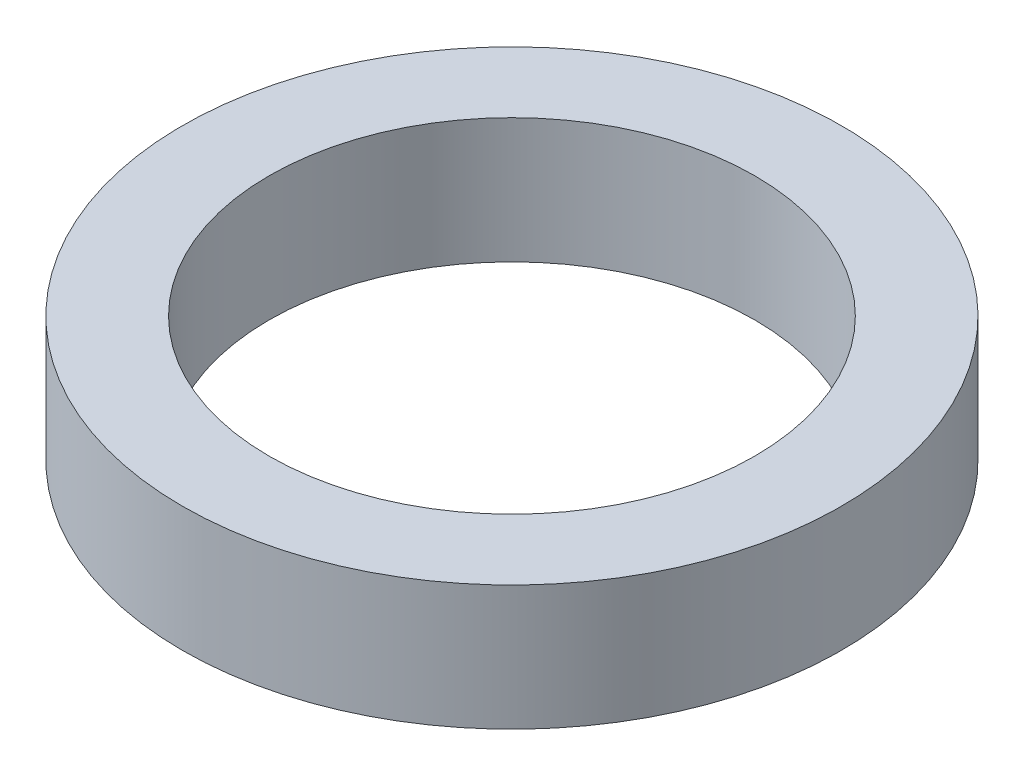
from build123d import *

# Parameters (mm, degrees)
SKETCH1_R           = 47.5
BOSS_EXTRUDE1_DEPTH = 18
SKETCH2_R           = 35
CUT_EXTRUDE1_DEPTH  = 70.544949493


with BuildPart() as part:
    # Sketch1 → Boss-Extrude1 (new body)
    with BuildSketch(Plane(origin=(0, 0, 0), x_dir=(1, 0, 0), z_dir=(0, 1, 0))):
        Circle(SKETCH1_R)
    extrude(amount=BOSS_EXTRUDE1_DEPTH)

    # Sketch2 → Cut-Extrude1 (cut, through all)
    with BuildSketch(Plane(origin=(0, 0, 0), x_dir=(1, 0, 0), z_dir=(0, 1, 0))):
        Circle(SKETCH2_R)
    extrude(amount=CUT_EXTRUDE1_DEPTH, mode=Mode.SUBTRACT)


solid = part.part
